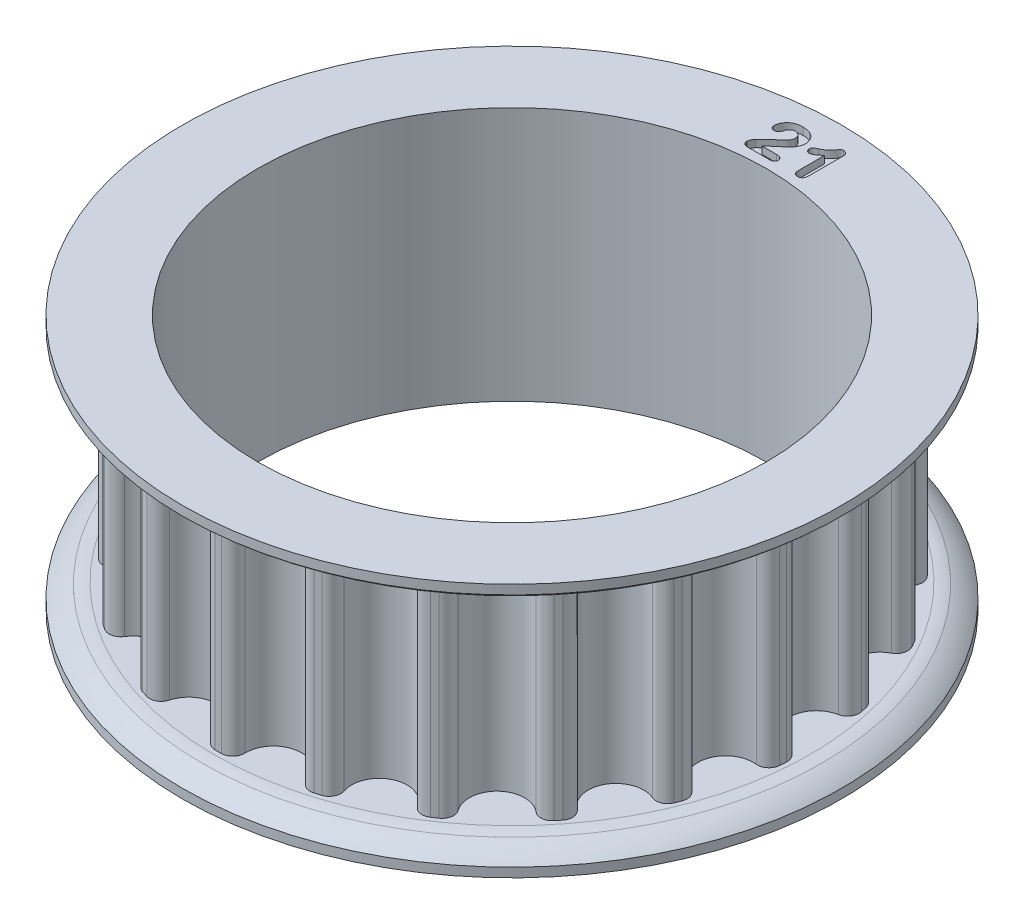
from build123d import *

# Parameters (mm, degrees)
SKETCH1_R               = 16.13976871
TOOTHOD_DEPTH           = 5.715
TOOTHPROFILE_DEPTH      = 26.527028187
TOOTHPATTERN_COUNT      = 21
BORE_DEPTH              = 27.544472426
BORE_DEPTH_BACK         = 27.544472426
SKETCH7_R               = 13.97
LARGE_TOOTH_COUNT_DEPTH = 0.4


with BuildPart() as part:
    # Sketch1 → ToothOD (new, symmetric)
    with BuildSketch(Plane(origin=(0, 0, 0), x_dir=(1, 0, 0), z_dir=(0, 1, 0))):
        Circle(SKETCH1_R)
    extrude(amount=TOOTHOD_DEPTH, both=True)

    # Sketch2 → ToothProfile (cut, through all)
    with BuildSketch(Plane(origin=(0, 5.715, 0), x_dir=(1, 0, 0), z_dir=(0, 1, 0))):
        with BuildLine():
            ThreePointArc((-1.514819148, 15.428848418), (0, 14.07976871), (1.514819148, 15.428848418))
            ThreePointArc((1.514819148, 15.428848418), (1.757165873, 15.857950358), (2.233452437, 15.984486987))
            ThreePointArc((2.233452437, 15.984486987), (0, 16.13976871), (-2.233452437, 15.984486987))
            ThreePointArc((-2.233452437, 15.984486987), (-1.757165873, 15.857950358), (-1.514819148, 15.428848418))
        make_face()
    toothprofile = extrude(amount=-TOOTHPROFILE_DEPTH, mode=Mode.SUBTRACT)

    # ToothPattern: ToothProfile ×21 about axis
    toothpattern_axis = Axis((0, 5.715, 0), (0, -1, 0))
    for i in range(1, TOOTHPATTERN_COUNT):
        add(toothprofile.rotate(toothpattern_axis, i * 360 / TOOTHPATTERN_COUNT), mode=Mode.SUBTRACT)

    # Sketch4 → Flange (revolve)
    with BuildSketch(Plane.XY):
        with BuildLine():
            Line((0, -5.715), (16.39376871, -5.715))
            ThreePointArc((16.39376871, -5.715), (16.7195247, -5.740622571), (17.039341039, -5.807637424))
            ThreePointArc((17.039341039, -5.807637424), (17.607069616, -6.089197125), (18.10826871, -6.477))
            Line((18.10826871, -6.477), (18.10826871, -6.985))
            Line((18.10826871, -6.985), (0, -6.985))
            Line((0, -6.985), (0, -5.715))
        make_face()
        with BuildLine():
            Line((18.10826871, 6.985), (18.10826871, 6.477))
            ThreePointArc((18.10826871, 6.477), (17.607069616, 6.089197125), (17.039341039, 5.807637424))
            ThreePointArc((17.039341039, 5.807637424), (16.7195247, 5.740622571), (16.39376871, 5.715))
            Line((16.39376871, 5.715), (0, 5.715))
            Line((0, 5.715), (0, 6.985))
            Line((0, 6.985), (18.10826871, 6.985))
        make_face()
    revolve(axis=Axis((0, 7.858125, 0), (0, -1, 0)))

    # Sketch7 → Bore (cut, two sides: drawn at the far end of the back side and taken through both)
    with BuildSketch(Plane.XZ.offset(-BORE_DEPTH_BACK)):
        Circle(SKETCH7_R)
    extrude(amount=BORE_DEPTH + BORE_DEPTH_BACK, mode=Mode.SUBTRACT)

    # Sketch9 → Large Tooth Count (cut)
    with BuildSketch(Plane(origin=(0, 6.985, 0), x_dir=(1, 0, 0), z_dir=(0, 1, 0))):
        with BuildLine():
            Line((-1.17475, 14.918306129), (-0.380503906, 14.918306129))
            add(Edge.make_bspline(
                [(-0.380503906, 14.918306129), (-0.355804804, 14.917682907), (-0.309030284, 14.916502664), (-0.243428178, 14.904118762), (-0.186528488, 14.883888919), (-0.139033156, 14.85562971), (-0.101393999, 14.82140095), (-0.074037597, 14.782715406), (-0.05719802, 14.739856105), (-0.055122246, 14.709761932), (-0.054074219, 14.694567848)],
                knots=[0, 0, 0, 0, 1.343135754, 2.543595783, 3.617176489, 4.61442092, 5.531765965, 6.365790276, 7.174912707, 8, 8, 8, 8], degree=3))
            add(Edge.make_bspline(
                [(-0.054074219, 14.694567848), (-0.054802085, 14.680914227), (-0.056261987, 14.653528763), (-0.069398545, 14.613617613), (-0.090815368, 14.575898238), (-0.119929687, 14.540631431), (-0.158258195, 14.509803266), (-0.207543811, 14.48879411), (-0.265920631, 14.476030606), (-0.30799964, 14.474578885), (-0.330398438, 14.473806129)],
                knots=[0, 0, 0, 0, 0.824179157, 1.653080055, 2.512971333, 3.436438535, 4.405072091, 5.457340227, 6.646533722, 8, 8, 8, 8], degree=3))
            Line((-0.330398438, 14.473806129), (-1.536898438, 14.473806129))
            add(Edge.make_bspline(
                [(-1.536898438, 14.473806129), (-1.558472167, 14.474747701), (-1.599630029, 14.476544009), (-1.658082736, 14.490418249), (-1.709286326, 14.514606965), (-1.752624345, 14.547943859), (-1.786632726, 14.588103917), (-1.811741068, 14.63229278), (-1.827332638, 14.680148984), (-1.829165097, 14.713470809), (-1.830089844, 14.730286598)],
                knots=[0, 0, 0, 0, 1.188346208, 2.267099395, 3.286301641, 4.287122075, 5.25691743, 6.166969209, 7.074964888, 8, 8, 8, 8], degree=3))
            add(Edge.make_bspline(
                [(-1.830089844, 14.730286598), (-1.82945326, 14.742077618), (-1.82809279, 14.767276672), (-1.81802838, 14.806856447), (-1.803891207, 14.850945351), (-1.783601434, 14.897581453), (-1.760792521, 14.944322087), (-1.735670977, 14.987318721), (-1.709387952, 15.025259736), (-1.689753106, 15.047140248), (-1.680269531, 15.057708473)],
                knots=[0, 0, 0, 0, 0.772497252, 1.650934469, 2.665768415, 3.807487169, 4.98083678, 6.074173258, 7.069831195, 8, 8, 8, 8], degree=3))
            add(Edge.make_bspline(
                [(-1.680269531, 15.057708473), (-1.644035421, 15.094730938), (-1.574101955, 15.166185965), (-1.470555323, 15.267208505), (-1.374109598, 15.360134187), (-1.297309351, 15.431321971), (-1.23997077, 15.483451958), (-1.20075337, 15.517962836), (-1.165078366, 15.549658695), (-1.131700628, 15.577053388), (-1.102112959, 15.602111382), (-1.075294446, 15.623421764), (-1.051577987, 15.641444775), (-1.036380199, 15.651754679), (-1.029394531, 15.656493629)],
                knots=[0, 0, 0, 0, 2.106460972, 4.065564631, 5.88232778, 7.552435621, 8.323665149, 9.033433807, 9.676767744, 10.26395234, 10.78914621, 11.253325952, 11.656791058, 12, 12, 12, 12], degree=3))
            add(Edge.make_bspline(
                [(-1.029394531, 15.656493629), (-1.008100325, 15.67169795), (-0.966690791, 15.701264859), (-0.908607017, 15.747117736), (-0.856992368, 15.79358195), (-0.81034503, 15.839192122), (-0.769506063, 15.885410695), (-0.734191479, 15.932030152), (-0.704185654, 15.978984079), (-0.679139431, 16.025994093), (-0.660078043, 16.073185347), (-0.644945306, 16.119397262), (-0.637105315, 16.165385255), (-0.635693618, 16.19572389), (-0.635, 16.210630348)],
                knots=[0, 0, 0, 0, 1.334834965, 2.595771614, 3.772830874, 4.876488071, 5.92253324, 6.916378838, 7.85720954, 8.762924605, 9.629317751, 10.451189837, 11.239014127, 12, 12, 12, 12], degree=3))
            add(Edge.make_bspline(
                [(-0.635, 16.210630348), (-0.63557668, 16.226050246), (-0.636701897, 16.256137525), (-0.645411493, 16.30007768), (-0.659757467, 16.341594223), (-0.680292652, 16.380073347), (-0.705082453, 16.415594933), (-0.734491604, 16.446994199), (-0.768185045, 16.474008719), (-0.80541105, 16.49670422), (-0.845448109, 16.515217774), (-0.88806427, 16.527943578), (-0.932491171, 16.536334234), (-0.9628789, 16.537144845), (-0.978296875, 16.537556129)],
                knots=[0, 0, 0, 0, 1.048524963, 2.045880207, 3.035079073, 4.026514865, 5.003545842, 5.974663832, 6.942844473, 7.932746918, 8.934660944, 9.934741294, 10.952139253, 12, 12, 12, 12], degree=3))
            add(Edge.make_bspline(
                [(-0.978296875, 16.537556129), (-0.992402558, 16.537188342), (-1.020219282, 16.536463056), (-1.060692036, 16.527427481), (-1.099462324, 16.514049004), (-1.136388025, 16.495029907), (-1.171419292, 16.470300207), (-1.204536992, 16.440358877), (-1.236368104, 16.405392784), (-1.254607433, 16.378719691), (-1.264046875, 16.364915504)],
                knots=[0, 0, 0, 0, 0.968576666, 1.910054901, 2.83824492, 3.784521401, 4.756498814, 5.779585462, 6.850863807, 8, 8, 8, 8], degree=3))
            add(Edge.make_bspline(
                [(-1.264046875, 16.364915504), (-1.265923225, 16.361136697), (-1.271503607, 16.349898289), (-1.279747767, 16.325746732), (-1.294286291, 16.290144695), (-1.309714662, 16.24377585), (-1.329529783, 16.193966006), (-1.352612707, 16.145900043), (-1.379353709, 16.103035228), (-1.406692224, 16.06309583), (-1.442160272, 16.030136185), (-1.487192125, 16.00725067), (-1.541277164, 15.993950025), (-1.580142304, 15.992582957), (-1.600894531, 15.991853004)],
                knots=[0, 0, 0, 0, 0.277128514, 0.824197545, 1.674066046, 2.805212172, 4.034469565, 5.196326461, 6.303667431, 7.353778336, 8.369399301, 9.448751033, 10.637748383, 12, 12, 12, 12], degree=3))
            add(Edge.make_bspline(
                [(-1.600894531, 15.991853004), (-1.616180684, 15.99259299), (-1.646086916, 15.994040719), (-1.68905495, 16.006073427), (-1.727403458, 16.027127402), (-1.761350035, 16.054956975), (-1.789657559, 16.089748814), (-1.808718746, 16.131489991), (-1.821206006, 16.1779962), (-1.822480726, 16.210873124), (-1.823144531, 16.227993629)],
                knots=[0, 0, 0, 0, 1.006577142, 1.969294067, 2.910545259, 3.870728958, 4.847838899, 5.837573602, 6.873926541, 8, 8, 8, 8], degree=3))
            add(Edge.make_bspline(
                [(-1.823144531, 16.227993629), (-1.822436115, 16.248538841), (-1.821005637, 16.290025035), (-1.810431458, 16.352630607), (-1.794110349, 16.416281427), (-1.770911294, 16.480516181), (-1.740660207, 16.543530658), (-1.704619525, 16.604649314), (-1.660645532, 16.661587262), (-1.611959456, 16.716617549), (-1.555478935, 16.766798642), (-1.491996993, 16.812241117), (-1.421387058, 16.852186284), (-1.34403892, 16.887246276), (-1.259686643, 16.915535948), (-1.168395357, 16.935570638), (-1.07060184, 16.948364376), (-1.003143515, 16.949645717), (-0.968375, 16.950306129)],
                knots=[0, 0, 0, 0, 0.79066067, 1.596552158, 2.438066046, 3.318094126, 4.22076533, 5.12585777, 6.043865989, 6.985993145, 7.950839248, 8.945468985, 9.986194989, 11.068910188, 12.21037173, 13.404260134, 14.66213667, 16, 16, 16, 16], degree=3))
            add(Edge.make_bspline(
                [(-0.968375, 16.950306129), (-0.94620917, 16.950002663), (-0.902834011, 16.949408825), (-0.839122333, 16.945278577), (-0.778137309, 16.939154316), (-0.719915766, 16.929476196), (-0.66430709, 16.917922285), (-0.611582715, 16.902744768), (-0.561396312, 16.885744397), (-0.529574805, 16.871815781), (-0.513953125, 16.864978004)],
                knots=[0, 0, 0, 0, 1.141710532, 2.234153931, 3.287715026, 4.297387598, 5.273071892, 6.211454997, 7.121975032, 8, 8, 8, 8], degree=3))
            add(Edge.make_bspline(
                [(-0.513953125, 16.864978004), (-0.491896335, 16.854149952), (-0.448534873, 16.832863075), (-0.388351733, 16.794251079), (-0.333414408, 16.751706434), (-0.284744221, 16.704257082), (-0.241572543, 16.653370063), (-0.202858126, 16.599839334), (-0.170697232, 16.542171962), (-0.143498456, 16.482138415), (-0.122200371, 16.420139983), (-0.106821368, 16.357390392), (-0.096837838, 16.29412865), (-0.095778904, 16.251677233), (-0.09525, 16.230474098)],
                knots=[0, 0, 0, 0, 1.100471427, 2.163417708, 3.198242748, 4.209796447, 5.203380146, 6.186404149, 7.165424876, 8.157237974, 9.136931722, 10.098602738, 11.050312444, 12, 12, 12, 12], degree=3))
            add(Edge.make_bspline(
                [(-0.09525, 16.230474098), (-0.096462028, 16.197141175), (-0.098858892, 16.131223173), (-0.118864267, 16.034457512), (-0.151758446, 15.942029698), (-0.197278591, 15.855719123), (-0.248999823, 15.776702812), (-0.301239177, 15.704620585), (-0.355006619, 15.642557968), (-0.401386401, 15.596248496), (-0.441284775, 15.561653539), (-0.47465706, 15.532680027), (-0.512217664, 15.500623943), (-0.554096375, 15.465086342), (-0.600705101, 15.42675813), (-0.651145912, 15.384362227), (-0.706225706, 15.339431932), (-0.764070622, 15.292302698), (-0.82203457, 15.245004728), (-0.876250701, 15.198275543), (-0.926555501, 15.154861339), (-0.971965666, 15.113417914), (-1.012777395, 15.074343396), (-1.049949883, 15.038386386), (-1.081487811, 15.003932987), (-1.101026322, 14.981830887), (-1.110257813, 14.97138816)],
                knots=[0, 0, 0, 0, 1.436599664, 2.840968415, 4.241909903, 5.655071448, 7.037977016, 8.313294046, 9.491515882, 10.57584574, 11.13676856, 11.768818006, 12.482089669, 13.266552005, 14.137751607, 15.08474532, 16.108481255, 17.203478555, 18.302996106, 19.33499709, 20.290440541, 21.168908746, 21.986178864, 22.727567017, 23.398805086, 24, 24, 24, 24], degree=3))
            add(Edge.make_bspline(
                [(-1.110257813, 14.97138816), (-1.119582693, 14.961971916), (-1.139268779, 14.94209295), (-1.162515013, 14.926508537), (-1.17475, 14.918306129)],
                knots=[0, 0, 0, 0, 0.947357495, 2, 2, 2, 2], degree=3))
        make_face()
        with BuildLine():
            Line((0.98425, 14.737728004), (0.98425, 16.188306129))
            add(Edge.make_bspline(
                [(0.98425, 16.188306129), (0.955653295, 16.163293241), (0.90120079, 16.115664873), (0.820749887, 16.050927725), (0.745918216, 15.996031649), (0.676572168, 15.951190668), (0.61306508, 15.915919274), (0.555248961, 15.890660514), (0.502929962, 15.874322516), (0.469396805, 15.871916282), (0.453925781, 15.870806129)],
                knots=[0, 0, 0, 0, 1.452107273, 2.765034543, 3.945897232, 4.997908399, 5.920070119, 6.718510474, 7.408765629, 8, 8, 8, 8], degree=3))
            add(Edge.make_bspline(
                [(0.453925781, 15.870806129), (0.440432064, 15.871520586), (0.413883567, 15.87292626), (0.375563046, 15.8857089), (0.339846194, 15.905891291), (0.30770832, 15.933476219), (0.280417777, 15.96619313), (0.260930397, 16.003092872), (0.248219958, 16.042459537), (0.246786794, 16.069808625), (0.2460625, 16.083630348)],
                knots=[0, 0, 0, 0, 0.982678269, 1.933390929, 2.917255113, 3.962257531, 5.008793131, 6.008019064, 6.993289668, 8, 8, 8, 8], degree=3))
            add(Edge.make_bspline(
                [(0.2460625, 16.083630348), (0.246834046, 16.099068968), (0.248291393, 16.128230461), (0.258792858, 16.168932982), (0.278290386, 16.202696098), (0.306654459, 16.229579289), (0.343447705, 16.252774309), (0.3879342, 16.278340709), (0.441704967, 16.306850954), (0.481280251, 16.325259481), (0.502542969, 16.335149879)],
                knots=[0, 0, 0, 0, 0.959800551, 1.812935176, 2.587130183, 3.350598702, 4.217563363, 5.286346087, 6.542028024, 8, 8, 8, 8], degree=3))
            add(Edge.make_bspline(
                [(0.502542969, 16.335149879), (0.533494832, 16.350157346), (0.592914018, 16.378967615), (0.675454823, 16.426406272), (0.748911768, 16.474068031), (0.812802064, 16.524640609), (0.870367926, 16.577467203), (0.924276378, 16.632584456), (0.974608431, 16.691706848), (1.02053756, 16.751867945), (1.060733667, 16.808508977), (1.095799467, 16.854890336), (1.123223603, 16.889594132), (1.143837237, 16.915603016), (1.166511923, 16.932896731), (1.194799919, 16.943349095), (1.229873658, 16.949526932), (1.255582059, 16.950032402), (1.269503906, 16.950306129)],
                knots=[0, 0, 0, 0, 1.633066382, 3.135044738, 4.518110351, 5.78750681, 6.999314836, 8.226621731, 9.446368142, 10.684082489, 11.819758467, 12.744847819, 13.443941736, 13.922653104, 14.315303366, 14.780490369, 15.339600077, 16, 16, 16, 16], degree=3))
            add(Edge.make_bspline(
                [(1.269503906, 16.950306129), (1.289294139, 16.949499313), (1.327068659, 16.947959306), (1.380011686, 16.932322365), (1.425154462, 16.906011904), (1.461090797, 16.869195615), (1.489102201, 16.825922405), (1.509897216, 16.777509519), (1.521897596, 16.724005962), (1.523283606, 16.686775961), (1.524, 16.667532692)],
                knots=[0, 0, 0, 0, 1.104026993, 2.107306726, 3.052283825, 3.993636142, 4.95520013, 5.920268712, 6.92503816, 8, 8, 8, 8], degree=3))
            Line((1.524, 16.667532692), (1.524, 14.801228004))
            add(Edge.make_bspline(
                [(1.524, 14.801228004), (1.523266671, 14.773053909), (1.521889523, 14.720144613), (1.508661004, 14.646332333), (1.486737463, 14.583202414), (1.454639311, 14.531367514), (1.413153333, 14.490412111), (1.362113048, 14.46187015), (1.30218952, 14.444523958), (1.25937788, 14.442909174), (1.236761719, 14.442056129)],
                knots=[0, 0, 0, 0, 1.286563032, 2.416089802, 3.413012509, 4.323048118, 5.178141009, 6.048034207, 6.968832458, 8, 8, 8, 8], degree=3))
            add(Edge.make_bspline(
                [(1.236761719, 14.442056129), (1.218631899, 14.442964715), (1.183574254, 14.444721649), (1.133790925, 14.459584706), (1.089598648, 14.483898343), (1.051422973, 14.517558133), (1.020446958, 14.560602509), (0.999661757, 14.61273658), (0.98644056, 14.672582925), (0.985008893, 14.71515928), (0.98425, 14.737728004)],
                knots=[0, 0, 0, 0, 0.988661812, 1.911776046, 2.809258143, 3.724383738, 4.669377512, 5.677528055, 6.768912233, 8, 8, 8, 8], degree=3))
        make_face()
    extrude(amount=-LARGE_TOOTH_COUNT_DEPTH, mode=Mode.SUBTRACT)


solid = part.part
